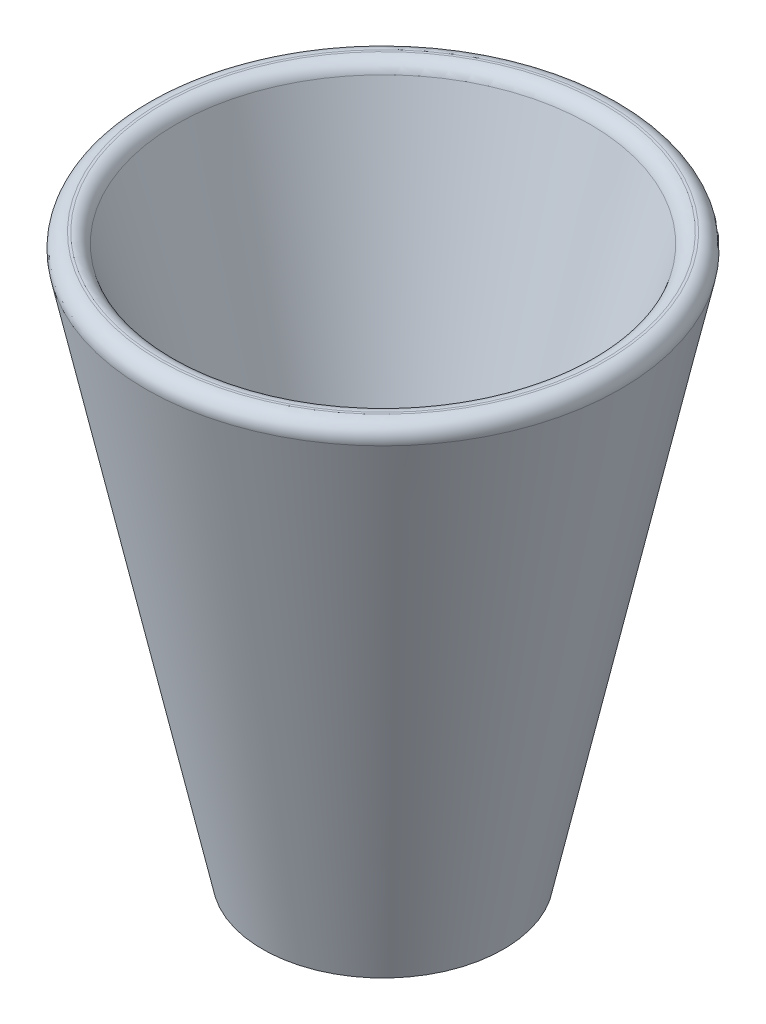
from build123d import *

# Parameters (mm, degrees)
FILLET1_R          = 1.524
SKETCH4_R          = 8.89
CUT_EXTRUDE1_DEPTH = 5.08
FILLET2_R          = 5.08


with BuildPart() as part:
    # Sketch3 → Revolve1 (revolve)
    with BuildSketch(Plane.XY, mode=Mode.PRIVATE) as revolve1_sk:
        with BuildLine():
            Line((0, 0), (12.7, 0))
            Line((12.7, 0), (25.4, 59.10038719))
            Line((25.4, 59.10038719), (22.140333333, 59.10038719))
            Line((22.140333333, 59.10038719), (9.228066554, 16.982885))
            ThreePointArc((9.228066554, 16.982885), (5.738226469, 12.050952327), (0, 10.16))
            Line((0, 10.16), (0, 0))
        make_face()
    revolve(revolve1_sk.sketch.rotate(Axis((0, 0, 0), (0, 1, 0)), 90), axis=Axis((0, 0, 0), (0, 1, 0)))

    # Fillet1
    fillet1_edges = [part.edges().sort_by_distance(p)[0] for p in [
        (0, 59.10038719, 25.4),
        (0, 59.10038719, 22.140333333),
    ]]
    fillet(fillet1_edges, radius=FILLET1_R)

    # Sketch4 → Cut-Extrude1 (cut)
    with BuildSketch(Plane.XZ):
        with Locations(Location((0, 0, 0), (0, 0, 270))):
            Circle(SKETCH4_R)
    extrude(amount=-CUT_EXTRUDE1_DEPTH, mode=Mode.SUBTRACT)

    # Fillet2
    fillet2_edges = [part.edges().sort_by_distance(p)[0] for p in [
        (0, 5.08, 8.89),
    ]]
    fillet(fillet2_edges, radius=FILLET2_R - 0.0001)  # a hair under: the kernel refuses the full size


solid = part.part
